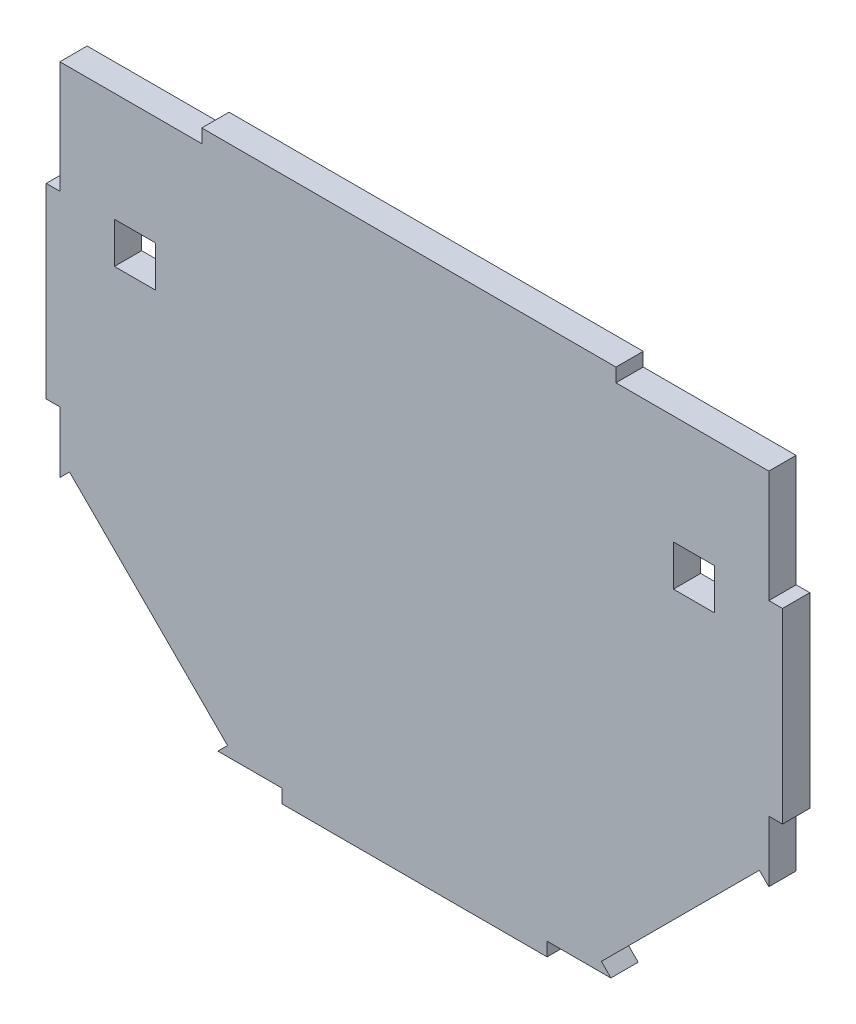
from build123d import *

# Parameters (mm, degrees)
BOSS_EXTRUDE1_DEPTH = 12.7
SKETCH2_W           = 19.05
SKETCH2_H           = 19.05
CUT_EXTRUDE1_DEPTH  = 1311.197009113
CUT_EXTRUDE2_DEPTH  = 1311.197009113


with BuildPart() as part:
    # Sketch1 → Boss-Extrude1 (new body)
    with BuildSketch(Plane.XY):
        Polygon((424.715446324, 892.207843626), (424.715446324, 920.715652439), (418.365446324, 920.715652439), (418.365446324, 1007.691853389), (424.715446324, 1007.691853389), (424.715446324, 1059.919118431), (490.806723979, 1059.919118431), (490.806723979, 1066.269118431), (683.70003755, 1066.269118431), (683.70003755, 1059.919118431), (754.915446324, 1059.919118431), (754.915446324, 1007.691853389), (761.265446324, 1007.691853389), (761.265446324, 920.715652439), (754.915446324, 920.715652439), (754.915446324, 892.207843626), (681.331146762, 818.667305174), (651.634447679, 818.667305174), (651.634447679, 812.317305174), (528.064815274, 812.317305174), (528.064815274, 818.667305174), (498.299745887, 818.667305174), align=None)
    extrude(amount=BOSS_EXTRUDE1_DEPTH)

    # Sketch2 → Cut-Extrude1 (cut, through all)
    with BuildSketch(Plane.XY.offset(12.7)):
        with Locations((459.640446324, 999.594118431)):
            Rectangle(SKETCH2_W, SKETCH2_H)
        with Locations((719.990446324, 999.594118431)):
            Rectangle(SKETCH2_W, SKETCH2_H)
    extrude(amount=-CUT_EXTRUDE1_DEPTH, mode=Mode.SUBTRACT)

    # Sketch3 → Cut-Extrude2 (cut, through all)
    with BuildSketch(Plane.XY.offset(12.7)):
        Polygon((429.204238634, 896.699307041), (502.788538196, 823.158768588), (498.299745887, 818.667305174), (424.715446324, 892.207843626), align=None)
        Polygon((750.49502432, 896.699307041), (754.983816629, 892.207843626), (681.399517067, 818.667305174), (676.910724758, 823.158768588), align=None)
    extrude(amount=-CUT_EXTRUDE2_DEPTH, mode=Mode.SUBTRACT)


solid = part.part
